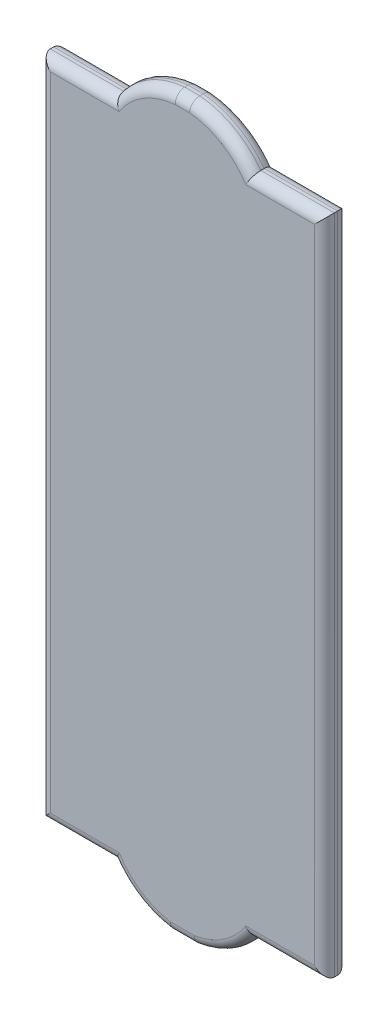
from build123d import *

# Parameters (mm, degrees)
ESBO_O1_W                  = 4.28
ESBO_O1_H                  = 11
RESSALTO_EXTRUS_O1_DEPTH   = 11
CORTE_EXTRUS_O1_DEPTH      = 14
CORTE_EXTRUS_O1_DEPTH_BACK = 8.18
CORTE_EXTRUS_O3_DEPTH      = 13
CORTE_EXTRUS_O3_DEPTH_BACK = 12.18
CORTE_EXTRUS_O5_DEPTH      = 7.18
CORTE_EXTRUS_O5_DEPTH_BACK = 13
FILETE2_R                  = 0.15


with BuildPart() as part:
    # Esboço1 → Ressalto-extrusão1 (new body)
    with BuildSketch(Plane(origin=(0, 0, 0), x_dir=(0, 0, -1), z_dir=(1, 0, 0))):
        Rectangle(ESBO_O1_W, ESBO_O1_H)
    extrude(amount=RESSALTO_EXTRUS_O1_DEPTH)

    # Esboço4 → Corte-extrusão1 (cut, two sides: drawn at the far end of the back side and taken through both)
    with BuildSketch(Plane(origin=(0, 0, -2.14), x_dir=(-1, 0, 0), z_dir=(0, 0, -1)).offset(-CORTE_EXTRUS_O1_DEPTH_BACK)):
        Polygon((-6.72, 5.5), (-6.72, -5.5), (-6.72, -6.924664603), (2.265516733, -6.924664603), (2.265516733, 6.311337166), (-6.479345422, 6.786171311), align=None)
    extrude(amount=CORTE_EXTRUS_O1_DEPTH + CORTE_EXTRUS_O1_DEPTH_BACK, mode=Mode.SUBTRACT)

    # Esboço5 → Corte-extrusão3 (cut, two sides: drawn at the far end of the back side and taken through both)
    with BuildSketch(Plane.XZ.offset(5.5).offset(-CORTE_EXTRUS_O3_DEPTH_BACK)):
        Polygon((6.019412649, -1.79), (11.617448209, -1.79), (11.996193189, 3.076148253), (6.185690933, 3.076148253), (6.019412649, -1.376414684), (6.019412649, -1.487266873), align=None)
    extrude(amount=CORTE_EXTRUS_O3_DEPTH + CORTE_EXTRUS_O3_DEPTH_BACK, mode=Mode.SUBTRACT)

    # Esboço6 → Corte-extrusão5 (cut, two sides: drawn at the far end of the back side and taken through both)
    with BuildSketch(Plane(origin=(0, 0, -2.14), x_dir=(-1, 0, 0), z_dir=(0, 0, -1)).offset(-CORTE_EXTRUS_O5_DEPTH_BACK)):
        with BuildLine():
            Line((-7.827235736, 4.985758514), (-6.355249889, 4.985758514))
            Line((-6.355249889, 4.985758514), (-5.940072912, 7.451017437))
            Line((-5.940072912, 7.451017437), (-11.125738277, 7.451017437))
            Line((-11.125738277, 7.451017437), (-11.364750111, 4.985758514))
            Line((-11.364750111, 4.985758514), (-9.892764264, 4.985758514))
            ThreePointArc((-9.892764264, 4.985758514), (-8.86, 5.50505659), (-7.827235736, 4.985758514))
        make_face()
        with BuildLine():
            Line((-7.827235736, -4.985758514), (-6.355249889, -4.985758514))
            Line((-6.355249889, -4.985758514), (-6.545759622, -6.950748332))
            Line((-6.545759622, -6.950748332), (-10.182890029, -6.950748332))
            Line((-10.182890029, -6.950748332), (-13.175715932, -6.660587814))
            Line((-13.175715932, -6.660587814), (-11.364750111, -4.985758514))
            Line((-11.364750111, -4.985758514), (-9.892764264, -4.985758514))
            ThreePointArc((-9.892764264, -4.985758514), (-8.86, -5.514320063), (-7.827235736, -4.985758514))
        make_face()
    extrude(amount=CORTE_EXTRUS_O5_DEPTH + CORTE_EXTRUS_O5_DEPTH_BACK, mode=Mode.SUBTRACT)

    # Filete2
    # the kernel refuses this fillet: 0.15 mm, written as the material it takes off along each edge
    with BuildSketch(Plane(origin=(9.34895697, 5.5, -1.79), x_dir=(0, -1, 0), z_dir=(-1, 0, 0)), Plane(origin=(8.37104303, 5.5, -2.14), x_dir=(0, -1, 0), z_dir=(1, 0, 0))) as filete2_piece_1:
        with BuildLine():
            CenterArc((FILETE2_R, -FILETE2_R), FILETE2_R, 90, 90)
            Line((0, -FILETE2_R), (0, 0))
            Line((0, 0), (FILETE2_R, 0))
        make_face()
    extrude(amount=0.977913941, mode=Mode.SUBTRACT)
    with BuildSketch(Plane(origin=(11.375, 4.985758514, -1.79), x_dir=(0, -1, 0), z_dir=(-1, 0, 0))) as filete2_piece_2_section:
        with BuildLine():
            CenterArc((FILETE2_R, -FILETE2_R), FILETE2_R, 90, 90)
            Line((0, -FILETE2_R), (0, 0))
            Line((0, 0), (FILETE2_R, 0))
        make_face()
    filete2_piece_2 = extrude(amount=1.857235736, mode=Mode.PRIVATE)
    filete2_piece_2 = filete2_piece_2 - Plane(origin=(8.86, 4.21844243, -1.824247576), x_dir=(0.8026992826896523, 0.5963839883577674, 0), z_dir=(0, 0, 1)) * Cylinder(1.28661416, 5, mode=Mode.PRIVATE)
    add(filete2_piece_2, mode=Mode.SUBTRACT)
    with BuildSketch(Plane(origin=(8.86, 4.21844243, -1.79), x_dir=(0.940229636725142, 0.34054108448718423, 0), z_dir=(0.34054108448718423, -0.940229636725142, 0))) as filete2_piece_3_section:
        with BuildLine():
            CenterArc((1.28661416 - FILETE2_R, -FILETE2_R), FILETE2_R, 0, 90)
            Line((1.28661416, -FILETE2_R), (1.28661416, 0))
            Line((1.28661416, 0), (1.28661416 - FILETE2_R, 0))
        make_face()
    filete2_piece_3 = revolve(axis=Axis((8.86, 4.21844243, -1.79), (0, 0, 1)), revolution_arc=81.710254876, mode=Mode.PRIVATE)
    filete2_piece_3 = split(filete2_piece_3, bisect_by=Plane(origin=(9.30349686, 4.985758514, -1.832519321), z_dir=(0, 1, 0)), keep=Keep.TOP, mode=Mode.PRIVATE)
    add(filete2_piece_3, mode=Mode.SUBTRACT)
    with BuildSketch(Plane(origin=(8.86, 4.21844243, -1.79), x_dir=(0.20142152320806478, 0.9795046554195355, 0), z_dir=(0.9795046554195355, -0.20142152320806478, 0))) as filete2_piece_4_section:
        with BuildLine():
            CenterArc((1.28661416 - FILETE2_R, -FILETE2_R), FILETE2_R, 0, 90)
            Line((1.28661416, -FILETE2_R), (1.28661416, 0))
            Line((1.28661416, 0), (1.28661416 - FILETE2_R, 0))
        make_face()
    filete2_piece_4 = revolve(axis=Axis((8.86, 4.21844243, -1.79), (0, 0, 1)), revolution_arc=81.710254876, mode=Mode.PRIVATE)
    filete2_piece_4 = split(filete2_piece_4, bisect_by=Plane(origin=(8.416503141, 4.985758514, -1.832519323), z_dir=(0, 1, 0)), keep=Keep.TOP, mode=Mode.PRIVATE)
    add(filete2_piece_4, mode=Mode.SUBTRACT)
    with BuildSketch(Plane(origin=(8.202235736, 4.985758514, -1.79), x_dir=(0, -1, 0), z_dir=(-1, 0, 0))) as filete2_piece_5_section:
        with BuildLine():
            CenterArc((FILETE2_R, -FILETE2_R), FILETE2_R, 90, 90)
            Line((0, -FILETE2_R), (0, 0))
            Line((0, 0), (FILETE2_R, 0))
        make_face()
    filete2_piece_5 = extrude(amount=1.857235736, mode=Mode.PRIVATE)
    filete2_piece_5 = filete2_piece_5 - Plane(origin=(8.86, 4.21844243, -1.824247576), x_dir=(0.8026992826896523, 0.5963839883577674, 0), z_dir=(0, 0, 1)) * Cylinder(1.28661416, 5, mode=Mode.PRIVATE)
    add(filete2_piece_5, mode=Mode.SUBTRACT)
    with BuildSketch(Plane(origin=(6.72, 5.360758514, -2.14), x_dir=(1, 0, 0), z_dir=(0, -1, 0)), Plane(origin=(6.72, -5.360758514, -1.79), x_dir=(1, 0, 0), z_dir=(0, 1, 0)), Plane(origin=(11, 5.360758514, -1.79), x_dir=(-1, 0, 0), z_dir=(0, -1, 0)), Plane(origin=(11, -5.360758514, -2.14), x_dir=(-1, 0, 0), z_dir=(0, 1, 0))) as filete2_piece_6:
        with BuildLine():
            CenterArc((FILETE2_R, FILETE2_R), FILETE2_R, 180, 90)
            Line((0, FILETE2_R), (0, 0))
            Line((0, 0), (FILETE2_R, 0))
        make_face()
    extrude(amount=10.721517028, mode=Mode.SUBTRACT)
    with BuildSketch(Plane(origin=(8.202235736, 4.985758514, -2.14), x_dir=(0, -1, 0), z_dir=(-1, 0, 0))) as filete2_piece_7_section:
        with BuildLine():
            CenterArc((FILETE2_R, FILETE2_R), FILETE2_R, 180, 90)
            Line((0, FILETE2_R), (0, 0))
            Line((0, 0), (FILETE2_R, 0))
        make_face()
    filete2_piece_7 = extrude(amount=1.857235736, mode=Mode.PRIVATE)
    filete2_piece_7 = filete2_piece_7 - Plane(origin=(8.86, 4.21844243, -2.105752424), x_dir=(0.8026992826896523, 0.5963839883577674, 0), z_dir=(0, 0, 1)) * Cylinder(1.28661416, 5, mode=Mode.PRIVATE)
    add(filete2_piece_7, mode=Mode.SUBTRACT)
    with BuildSketch(Plane(origin=(8.86, 4.21844243, -2.14), x_dir=(0.20142152320806478, 0.9795046554195355, 0), z_dir=(0.9795046554195355, -0.20142152320806478, 0))) as filete2_piece_8_section:
        with BuildLine():
            CenterArc((1.28661416 - FILETE2_R, FILETE2_R), FILETE2_R, 270, 90)
            Line((1.28661416, FILETE2_R), (1.28661416, 0))
            Line((1.28661416, 0), (1.28661416 - FILETE2_R, 0))
        make_face()
    filete2_piece_8 = revolve(axis=Axis((8.86, 4.21844243, -2.14), (0, 0, 1)), revolution_arc=81.710254876, mode=Mode.PRIVATE)
    filete2_piece_8 = split(filete2_piece_8, bisect_by=Plane(origin=(8.416503141, 4.985758514, -2.097480677), z_dir=(0, 1, 0)), keep=Keep.TOP, mode=Mode.PRIVATE)
    add(filete2_piece_8, mode=Mode.SUBTRACT)
    with BuildSketch(Plane(origin=(8.86, 4.21844243, -2.14), x_dir=(0.940229636725142, 0.34054108448718423, 0), z_dir=(0.34054108448718423, -0.940229636725142, 0))) as filete2_piece_9_section:
        with BuildLine():
            CenterArc((1.28661416 - FILETE2_R, FILETE2_R), FILETE2_R, 270, 90)
            Line((1.28661416, FILETE2_R), (1.28661416, 0))
            Line((1.28661416, 0), (1.28661416 - FILETE2_R, 0))
        make_face()
    filete2_piece_9 = revolve(axis=Axis((8.86, 4.21844243, -2.14), (0, 0, 1)), revolution_arc=81.710254876, mode=Mode.PRIVATE)
    filete2_piece_9 = split(filete2_piece_9, bisect_by=Plane(origin=(9.30349686, 4.985758514, -2.097480679), z_dir=(0, 1, 0)), keep=Keep.TOP, mode=Mode.PRIVATE)
    add(filete2_piece_9, mode=Mode.SUBTRACT)
    with BuildSketch(Plane(origin=(11.375, 4.985758514, -2.14), x_dir=(0, -1, 0), z_dir=(-1, 0, 0))) as filete2_piece_10_section:
        with BuildLine():
            CenterArc((FILETE2_R, FILETE2_R), FILETE2_R, 180, 90)
            Line((0, FILETE2_R), (0, 0))
            Line((0, 0), (FILETE2_R, 0))
        make_face()
    filete2_piece_10 = extrude(amount=1.857235736, mode=Mode.PRIVATE)
    filete2_piece_10 = filete2_piece_10 - Plane(origin=(8.86, 4.21844243, -2.105752424), x_dir=(0.8026992826896523, 0.5963839883577674, 0), z_dir=(0, 0, 1)) * Cylinder(1.28661416, 5, mode=Mode.PRIVATE)
    add(filete2_piece_10, mode=Mode.SUBTRACT)
    with BuildSketch(Plane(origin=(8.294577036, -5.5, -1.79), x_dir=(0, 0, -1), z_dir=(1, 0, 0))) as filete2_piece_11:
        with BuildLine():
            CenterArc((FILETE2_R, FILETE2_R), FILETE2_R, 180, 90)
            Line((0, FILETE2_R), (0, 0))
            Line((0, 0), (FILETE2_R, 0))
        make_face()
    extrude(amount=1.130845928, mode=Mode.SUBTRACT)
    with BuildSketch(Plane(origin=(8.202235736, -4.985758514, -1.79), x_dir=(0, 1, 0), z_dir=(-1, 0, 0))) as filete2_piece_12_section:
        with BuildLine():
            CenterArc((FILETE2_R, FILETE2_R), FILETE2_R, 180, 90)
            Line((0, FILETE2_R), (0, 0))
            Line((0, 0), (FILETE2_R, 0))
        make_face()
    filete2_piece_12 = extrude(amount=1.857235736, mode=Mode.PRIVATE)
    filete2_piece_12 = filete2_piece_12 - Plane(origin=(8.86, -4.24107257, -1.824238656), x_dir=(0.8111260921200049, -0.5848713214734753, 0), z_dir=(0, 0, 1)) * Cylinder(1.273247493, 5, mode=Mode.PRIVATE)
    add(filete2_piece_12, mode=Mode.SUBTRACT)
    with BuildSketch(Plane(origin=(8.86, -4.24107257, -1.79), x_dir=(-0.9459877087145345, -0.324202490676776, 0), z_dir=(-0.324202490676776, 0.9459877087145345, 0))) as filete2_piece_13_section:
        with BuildLine():
            CenterArc((1.273247493 - FILETE2_R, -FILETE2_R), FILETE2_R, 0, 90)
            Line((1.273247493, -FILETE2_R), (1.273247493, 0))
            Line((1.273247493, 0), (1.273247493 - FILETE2_R, 0))
        make_face()
    filete2_piece_13 = revolve(axis=Axis((8.86, -4.24107257, -1.79), (0, 0, 1)), revolution_arc=79.358119844, mode=Mode.PRIVATE)
    filete2_piece_13 = split(filete2_piece_13, bisect_by=Plane(origin=(8.379810513, -4.985758514, -1.832543049), z_dir=(0, -1, 0)), keep=Keep.TOP, mode=Mode.PRIVATE)
    add(filete2_piece_13, mode=Mode.SUBTRACT)
    with BuildSketch(Plane(origin=(8.86, -4.24107257, -1.79), x_dir=(-0.14393107441873307, -0.9895877150695988, 0), z_dir=(-0.9895877150695988, 0.14393107441873307, 0))) as filete2_piece_14_section:
        with BuildLine():
            CenterArc((1.273247493 - FILETE2_R, -FILETE2_R), FILETE2_R, 0, 90)
            Line((1.273247493 - FILETE2_R, 0), (1.273247493, 0))
            Line((1.273247493, 0), (1.273247493, -FILETE2_R))
        make_face()
    filete2_piece_14 = revolve(axis=Axis((8.86, -4.24107257, -1.79), (0, 0, 1)), revolution_arc=79.358119844, mode=Mode.PRIVATE)
    filete2_piece_14 = split(filete2_piece_14, bisect_by=Plane(origin=(9.340189487, -4.985758514, -1.83254305), z_dir=(0, -1, 0)), keep=Keep.TOP, mode=Mode.PRIVATE)
    add(filete2_piece_14, mode=Mode.SUBTRACT)
    with BuildSketch(Plane(origin=(11.375, -4.985758514, -1.79), x_dir=(0, 1, 0), z_dir=(-1, 0, 0))) as filete2_piece_15_section:
        with BuildLine():
            CenterArc((FILETE2_R, FILETE2_R), FILETE2_R, 180, 90)
            Line((0, FILETE2_R), (0, 0))
            Line((0, 0), (FILETE2_R, 0))
        make_face()
    filete2_piece_15 = extrude(amount=1.857235736, mode=Mode.PRIVATE)
    filete2_piece_15 = filete2_piece_15 - Plane(origin=(8.86, -4.24107257, -1.824238656), x_dir=(0.8111260921200049, -0.5848713214734753, 0), z_dir=(0, 0, 1)) * Cylinder(1.273247493, 5, mode=Mode.PRIVATE)
    add(filete2_piece_15, mode=Mode.SUBTRACT)
    with BuildSketch(Plane(origin=(8.294577036, -5.5, -2.14), x_dir=(0, 0, 1), z_dir=(1, 0, 0))) as filete2_piece_16:
        with BuildLine():
            CenterArc((FILETE2_R, -FILETE2_R), FILETE2_R, 90, 90)
            Line((0, -FILETE2_R), (0, 0))
            Line((0, 0), (FILETE2_R, 0))
        make_face()
    extrude(amount=1.130845928, mode=Mode.SUBTRACT)
    with BuildSketch(Plane(origin=(11.375, -4.985758514, -2.14), x_dir=(0, 1, 0), z_dir=(-1, 0, 0))) as filete2_piece_17_section:
        with BuildLine():
            CenterArc((FILETE2_R, -FILETE2_R), FILETE2_R, 90, 90)
            Line((0, -FILETE2_R), (0, 0))
            Line((0, 0), (FILETE2_R, 0))
        make_face()
    filete2_piece_17 = extrude(amount=1.857235736, mode=Mode.PRIVATE)
    filete2_piece_17 = filete2_piece_17 - Plane(origin=(8.86, -4.24107257, -2.105761344), x_dir=(0.8111260921200049, -0.5848713214734753, 0), z_dir=(0, 0, 1)) * Cylinder(1.273247493, 5, mode=Mode.PRIVATE)
    add(filete2_piece_17, mode=Mode.SUBTRACT)
    with BuildSketch(Plane(origin=(8.86, -4.24107257, -2.14), x_dir=(-0.14393107441877348, -0.9895877150695928, 0), z_dir=(-0.9895877150695928, 0.14393107441877348, 0))) as filete2_piece_18_section:
        with BuildLine():
            CenterArc((1.273247493 - FILETE2_R, FILETE2_R), FILETE2_R, 270, 90)
            Line((1.273247493, FILETE2_R), (1.273247493, 0))
            Line((1.273247493, 0), (1.273247493 - FILETE2_R, 0))
        make_face()
    filete2_piece_18 = revolve(axis=Axis((8.86, -4.24107257, -2.14), (0, 0, 1)), revolution_arc=79.358119844, mode=Mode.PRIVATE)
    filete2_piece_18 = split(filete2_piece_18, bisect_by=Plane(origin=(9.340189487, -4.985758514, -2.09745695), z_dir=(0, -1, 0)), keep=Keep.TOP, mode=Mode.PRIVATE)
    add(filete2_piece_18, mode=Mode.SUBTRACT)
    with BuildSketch(Plane(origin=(8.86, -4.24107257, -2.14), x_dir=(-0.9459877087145341, -0.3242024906767768, 0), z_dir=(-0.3242024906767768, 0.9459877087145341, 0))) as filete2_piece_19_section:
        with BuildLine():
            CenterArc((1.273247493 - FILETE2_R, FILETE2_R), FILETE2_R, 270, 90)
            Line((1.273247493, FILETE2_R), (1.273247493, 0))
            Line((1.273247493, 0), (1.273247493 - FILETE2_R, 0))
        make_face()
    filete2_piece_19 = revolve(axis=Axis((8.86, -4.24107257, -2.14), (0, 0, 1)), revolution_arc=79.358119844, mode=Mode.PRIVATE)
    filete2_piece_19 = split(filete2_piece_19, bisect_by=Plane(origin=(8.379810513, -4.985758514, -2.097456951), z_dir=(0, -1, 0)), keep=Keep.TOP, mode=Mode.PRIVATE)
    add(filete2_piece_19, mode=Mode.SUBTRACT)
    with BuildSketch(Plane(origin=(8.202235736, -4.985758514, -2.14), x_dir=(0, 1, 0), z_dir=(-1, 0, 0))) as filete2_piece_20_section:
        with BuildLine():
            CenterArc((FILETE2_R, -FILETE2_R), FILETE2_R, 90, 90)
            Line((0, -FILETE2_R), (0, 0))
            Line((0, 0), (FILETE2_R, 0))
        make_face()
    filete2_piece_20 = extrude(amount=1.857235736, mode=Mode.PRIVATE)
    filete2_piece_20 = filete2_piece_20 - Plane(origin=(8.86, -4.24107257, -2.105761344), x_dir=(0.8111260921200049, -0.5848713214734753, 0), z_dir=(0, 0, 1)) * Cylinder(1.273247493, 5, mode=Mode.PRIVATE)
    add(filete2_piece_20, mode=Mode.SUBTRACT)
    with BuildSketch(Plane(origin=(8.86, 4.21844243, -1.79), x_dir=(0.940229636725142, 0.34054108448718423, 0), z_dir=(0.34054108448718423, -0.940229636725142, 0))) as filete2_piece_21a_section:
        with BuildLine():
            CenterArc((1.28661416 - FILETE2_R, -FILETE2_R), FILETE2_R, 0, 90)
            Line((1.28661416, -FILETE2_R), (1.28661416, 0))
            Line((1.28661416, 0), (1.28661416 - FILETE2_R, 0))
        make_face()
    filete2_piece_21a = revolve(axis=Axis((8.86, 4.21844243, -1.79), (0, 0, 1)), revolution_arc=81.710254876, mode=Mode.PRIVATE)
    filete2_piece_21a = split(filete2_piece_21a, bisect_by=Plane(origin=(9.951335845, 4.985758514, -1.823219459), z_dir=(0, -1, 0)), keep=Keep.TOP, mode=Mode.PRIVATE)
    with BuildSketch(Plane(origin=(11.375, 4.985758514, -1.79), x_dir=(0, -1, 0), z_dir=(-1, 0, 0))) as filete2_piece_21b_section:
        with BuildLine():
            CenterArc((FILETE2_R, -FILETE2_R), FILETE2_R, 90, 90)
            Line((0, -FILETE2_R), (0, 0))
            Line((0, 0), (FILETE2_R, 0))
        make_face()
    filete2_piece_21b = extrude(amount=1.857235736, mode=Mode.PRIVATE)
    filete2_piece_21b = filete2_piece_21b & Plane(origin=(8.86, 4.21844243, -1.822904463), x_dir=(0.8026992826896523, 0.5963839883577674, 0), z_dir=(0, 0, 1)) * Cylinder(1.28661416, 5, mode=Mode.PRIVATE)
    filete2_piece_21 = filete2_piece_21a & filete2_piece_21b
    add(filete2_piece_21, mode=Mode.SUBTRACT)
    with BuildSketch(Plane(origin=(8.202235736, 4.985758514, -1.79), x_dir=(0, -1, 0), z_dir=(-1, 0, 0))) as filete2_piece_22a_section:
        with BuildLine():
            CenterArc((FILETE2_R, -FILETE2_R), FILETE2_R, 90, 90)
            Line((0, -FILETE2_R), (0, 0))
            Line((0, 0), (FILETE2_R, 0))
        make_face()
    filete2_piece_22a = extrude(amount=1.857235736, mode=Mode.PRIVATE)
    filete2_piece_22a = filete2_piece_22a & Plane(origin=(8.86, 4.21844243, -1.822904463), x_dir=(0.8026992826896523, 0.5963839883577674, 0), z_dir=(0, 0, 1)) * Cylinder(1.28661416, 5, mode=Mode.PRIVATE)
    with BuildSketch(Plane(origin=(8.86, 4.21844243, -1.79), x_dir=(0.20142152320806478, 0.9795046554195355, 0), z_dir=(0.9795046554195355, -0.20142152320806478, 0))) as filete2_piece_22b_section:
        with BuildLine():
            CenterArc((1.28661416 - FILETE2_R, -FILETE2_R), FILETE2_R, 0, 90)
            Line((1.28661416, -FILETE2_R), (1.28661416, 0))
            Line((1.28661416, 0), (1.28661416 - FILETE2_R, 0))
        make_face()
    filete2_piece_22b = revolve(axis=Axis((8.86, 4.21844243, -1.79), (0, 0, 1)), revolution_arc=81.710254876, mode=Mode.PRIVATE)
    filete2_piece_22b = split(filete2_piece_22b, bisect_by=Plane(origin=(7.768663503, 4.985758514, -1.823219564), z_dir=(0, -1, 0)), keep=Keep.TOP, mode=Mode.PRIVATE)
    filete2_piece_22 = filete2_piece_22a & filete2_piece_22b
    add(filete2_piece_22, mode=Mode.SUBTRACT)
    with BuildSketch(Plane(origin=(8.202235736, 4.985758514, -2.14), x_dir=(0, -1, 0), z_dir=(-1, 0, 0))) as filete2_piece_23a_section:
        with BuildLine():
            CenterArc((FILETE2_R, FILETE2_R), FILETE2_R, 180, 90)
            Line((0, FILETE2_R), (0, 0))
            Line((0, 0), (FILETE2_R, 0))
        make_face()
    filete2_piece_23a = extrude(amount=1.857235736, mode=Mode.PRIVATE)
    filete2_piece_23a = filete2_piece_23a & Plane(origin=(8.86, 4.21844243, -2.107095537), x_dir=(0.8026992826896523, 0.5963839883577674, 0), z_dir=(0, 0, 1)) * Cylinder(1.28661416, 5, mode=Mode.PRIVATE)
    with BuildSketch(Plane(origin=(8.86, 4.21844243, -2.14), x_dir=(0.20142152320806478, 0.9795046554195355, 0), z_dir=(0.9795046554195355, -0.20142152320806478, 0))) as filete2_piece_23b_section:
        with BuildLine():
            CenterArc((1.28661416 - FILETE2_R, FILETE2_R), FILETE2_R, 270, 90)
            Line((1.28661416, FILETE2_R), (1.28661416, 0))
            Line((1.28661416, 0), (1.28661416 - FILETE2_R, 0))
        make_face()
    filete2_piece_23b = revolve(axis=Axis((8.86, 4.21844243, -2.14), (0, 0, 1)), revolution_arc=81.710254876, mode=Mode.PRIVATE)
    filete2_piece_23b = split(filete2_piece_23b, bisect_by=Plane(origin=(7.768663503, 4.985758514, -2.106780436), z_dir=(0, -1, 0)), keep=Keep.TOP, mode=Mode.PRIVATE)
    filete2_piece_23 = filete2_piece_23a & filete2_piece_23b
    add(filete2_piece_23, mode=Mode.SUBTRACT)
    with BuildSketch(Plane(origin=(8.86, 4.21844243, -2.14), x_dir=(0.940229636725142, 0.34054108448718423, 0), z_dir=(0.34054108448718423, -0.940229636725142, 0))) as filete2_piece_24a_section:
        with BuildLine():
            CenterArc((1.28661416 - FILETE2_R, FILETE2_R), FILETE2_R, 270, 90)
            Line((1.28661416, FILETE2_R), (1.28661416, 0))
            Line((1.28661416, 0), (1.28661416 - FILETE2_R, 0))
        make_face()
    filete2_piece_24a = revolve(axis=Axis((8.86, 4.21844243, -2.14), (0, 0, 1)), revolution_arc=81.710254876, mode=Mode.PRIVATE)
    filete2_piece_24a = split(filete2_piece_24a, bisect_by=Plane(origin=(9.951335845, 4.985758514, -2.106780541), z_dir=(0, -1, 0)), keep=Keep.TOP, mode=Mode.PRIVATE)
    with BuildSketch(Plane(origin=(11.375, 4.985758514, -2.14), x_dir=(0, -1, 0), z_dir=(-1, 0, 0))) as filete2_piece_24b_section:
        with BuildLine():
            CenterArc((FILETE2_R, FILETE2_R), FILETE2_R, 180, 90)
            Line((0, FILETE2_R), (0, 0))
            Line((0, 0), (FILETE2_R, 0))
        make_face()
    filete2_piece_24b = extrude(amount=1.857235736, mode=Mode.PRIVATE)
    filete2_piece_24b = filete2_piece_24b & Plane(origin=(8.86, 4.21844243, -2.107095537), x_dir=(0.8026992826896523, 0.5963839883577674, 0), z_dir=(0, 0, 1)) * Cylinder(1.28661416, 5, mode=Mode.PRIVATE)
    filete2_piece_24 = filete2_piece_24a & filete2_piece_24b
    add(filete2_piece_24, mode=Mode.SUBTRACT)
    with BuildSketch(Plane(origin=(8.86, -4.24107257, -1.79), x_dir=(-0.9459877087145345, -0.324202490676776, 0), z_dir=(-0.324202490676776, 0.9459877087145345, 0))) as filete2_piece_25a_section:
        with BuildLine():
            CenterArc((1.273247493 - FILETE2_R, -FILETE2_R), FILETE2_R, 0, 90)
            Line((1.273247493, -FILETE2_R), (1.273247493, 0))
            Line((1.273247493, 0), (1.273247493 - FILETE2_R, 0))
        make_face()
    filete2_piece_25a = revolve(axis=Axis((8.86, -4.24107257, -1.79), (0, 0, 1)), revolution_arc=79.358119844, mode=Mode.PRIVATE)
    filete2_piece_25a = split(filete2_piece_25a, bisect_by=Plane(origin=(7.770930707, -4.985758514, -1.823259416), z_dir=(0, 1, 0)), keep=Keep.TOP, mode=Mode.PRIVATE)
    with BuildSketch(Plane(origin=(8.202235736, -4.985758514, -1.79), x_dir=(0, 1, 0), z_dir=(-1, 0, 0))) as filete2_piece_25b_section:
        with BuildLine():
            CenterArc((FILETE2_R, FILETE2_R), FILETE2_R, 180, 90)
            Line((0, FILETE2_R), (0, 0))
            Line((0, 0), (FILETE2_R, 0))
        make_face()
    filete2_piece_25b = extrude(amount=1.857235736, mode=Mode.PRIVATE)
    filete2_piece_25b = filete2_piece_25b & Plane(origin=(8.86, -4.24107257, -1.822934762), x_dir=(0.8111260921200049, -0.5848713214734753, 0), z_dir=(0, 0, 1)) * Cylinder(1.273247493, 5, mode=Mode.PRIVATE)
    filete2_piece_25 = filete2_piece_25a & filete2_piece_25b
    add(filete2_piece_25, mode=Mode.SUBTRACT)
    with BuildSketch(Plane(origin=(8.86, -4.24107257, -1.79), x_dir=(-0.14393107441873307, -0.9895877150695988, 0), z_dir=(-0.9895877150695988, 0.14393107441873307, 0))) as filete2_piece_26a_section:
        with BuildLine():
            CenterArc((1.273247493 - FILETE2_R, -FILETE2_R), FILETE2_R, 0, 90)
            Line((1.273247493 - FILETE2_R, 0), (1.273247493, 0))
            Line((1.273247493, 0), (1.273247493, -FILETE2_R))
        make_face()
    filete2_piece_26a = revolve(axis=Axis((8.86, -4.24107257, -1.79), (0, 0, 1)), revolution_arc=79.358119844, mode=Mode.PRIVATE)
    filete2_piece_26a = split(filete2_piece_26a, bisect_by=Plane(origin=(9.949069162, -4.985758514, -1.82325941), z_dir=(0, 1, 0)), keep=Keep.TOP, mode=Mode.PRIVATE)
    with BuildSketch(Plane(origin=(11.375, -4.985758514, -1.79), x_dir=(0, 1, 0), z_dir=(-1, 0, 0))) as filete2_piece_26b_section:
        with BuildLine():
            CenterArc((FILETE2_R, FILETE2_R), FILETE2_R, 180, 90)
            Line((0, FILETE2_R), (0, 0))
            Line((0, 0), (FILETE2_R, 0))
        make_face()
    filete2_piece_26b = extrude(amount=1.857235736, mode=Mode.PRIVATE)
    filete2_piece_26b = filete2_piece_26b & Plane(origin=(8.86, -4.24107257, -1.822934762), x_dir=(0.8111260921200049, -0.5848713214734753, 0), z_dir=(0, 0, 1)) * Cylinder(1.273247493, 5, mode=Mode.PRIVATE)
    filete2_piece_26 = filete2_piece_26a & filete2_piece_26b
    add(filete2_piece_26, mode=Mode.SUBTRACT)
    with BuildSketch(Plane(origin=(11.375, -4.985758514, -2.14), x_dir=(0, 1, 0), z_dir=(-1, 0, 0))) as filete2_piece_27a_section:
        with BuildLine():
            CenterArc((FILETE2_R, -FILETE2_R), FILETE2_R, 90, 90)
            Line((0, -FILETE2_R), (0, 0))
            Line((0, 0), (FILETE2_R, 0))
        make_face()
    filete2_piece_27a = extrude(amount=1.857235736, mode=Mode.PRIVATE)
    filete2_piece_27a = filete2_piece_27a & Plane(origin=(8.86, -4.24107257, -2.107065238), x_dir=(0.8111260921200049, -0.5848713214734753, 0), z_dir=(0, 0, 1)) * Cylinder(1.273247493, 5, mode=Mode.PRIVATE)
    with BuildSketch(Plane(origin=(8.86, -4.24107257, -2.14), x_dir=(-0.14393107441877348, -0.9895877150695928, 0), z_dir=(-0.9895877150695928, 0.14393107441877348, 0))) as filete2_piece_27b_section:
        with BuildLine():
            CenterArc((1.273247493 - FILETE2_R, FILETE2_R), FILETE2_R, 270, 90)
            Line((1.273247493, FILETE2_R), (1.273247493, 0))
            Line((1.273247493, 0), (1.273247493 - FILETE2_R, 0))
        make_face()
    filete2_piece_27b = revolve(axis=Axis((8.86, -4.24107257, -2.14), (0, 0, 1)), revolution_arc=79.358119844, mode=Mode.PRIVATE)
    filete2_piece_27b = split(filete2_piece_27b, bisect_by=Plane(origin=(9.949069162, -4.985758514, -2.10674059), z_dir=(0, 1, 0)), keep=Keep.TOP, mode=Mode.PRIVATE)
    filete2_piece_27 = filete2_piece_27a & filete2_piece_27b
    add(filete2_piece_27, mode=Mode.SUBTRACT)
    with BuildSketch(Plane(origin=(8.86, -4.24107257, -2.14), x_dir=(-0.9459877087145341, -0.3242024906767768, 0), z_dir=(-0.3242024906767768, 0.9459877087145341, 0))) as filete2_piece_28a_section:
        with BuildLine():
            CenterArc((1.273247493 - FILETE2_R, FILETE2_R), FILETE2_R, 270, 90)
            Line((1.273247493, FILETE2_R), (1.273247493, 0))
            Line((1.273247493, 0), (1.273247493 - FILETE2_R, 0))
        make_face()
    filete2_piece_28a = revolve(axis=Axis((8.86, -4.24107257, -2.14), (0, 0, 1)), revolution_arc=79.358119844, mode=Mode.PRIVATE)
    filete2_piece_28a = split(filete2_piece_28a, bisect_by=Plane(origin=(7.770930707, -4.985758514, -2.106740584), z_dir=(0, 1, 0)), keep=Keep.TOP, mode=Mode.PRIVATE)
    with BuildSketch(Plane(origin=(8.202235736, -4.985758514, -2.14), x_dir=(0, 1, 0), z_dir=(-1, 0, 0))) as filete2_piece_28b_section:
        with BuildLine():
            CenterArc((FILETE2_R, -FILETE2_R), FILETE2_R, 90, 90)
            Line((0, -FILETE2_R), (0, 0))
            Line((0, 0), (FILETE2_R, 0))
        make_face()
    filete2_piece_28b = extrude(amount=1.857235736, mode=Mode.PRIVATE)
    filete2_piece_28b = filete2_piece_28b & Plane(origin=(8.86, -4.24107257, -2.107065238), x_dir=(0.8111260921200049, -0.5848713214734753, 0), z_dir=(0, 0, 1)) * Cylinder(1.273247493, 5, mode=Mode.PRIVATE)
    filete2_piece_28 = filete2_piece_28a & filete2_piece_28b
    add(filete2_piece_28, mode=Mode.SUBTRACT)


solid = part.part
